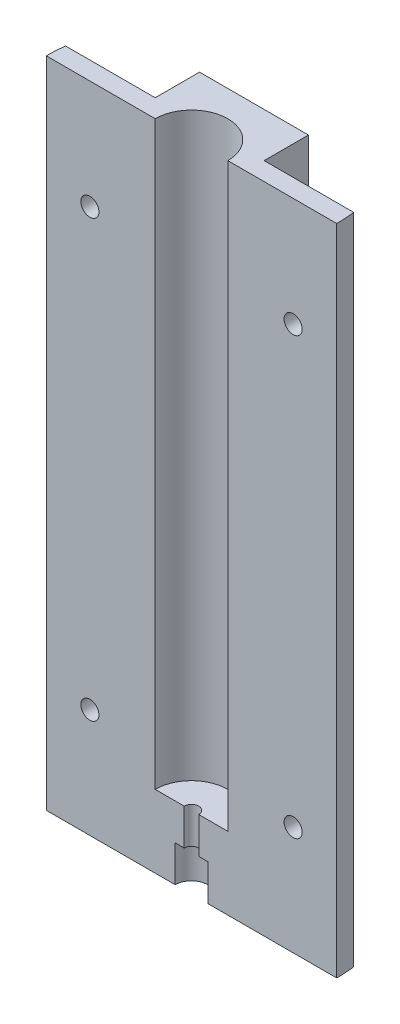
from build123d import *

# Parameters (mm, degrees)
AUFSATZ_LINEAR_AUSTRAGEN1_DEPTH       = 90
AUFSATZ_LINEAR_AUSTRAGEN1_DEPTH_BACK  = 0.0001
SCHNITT_LINEAR_AUSTRAGEN1_DEPTH       = 80
AUFSATZ_LINEAR_START                  = -10.0001
AUFSATZ_LINEAR_AUSTRAGEN2_DEPTH       = 10.0001
SKIZZE45_R                            = 2.25
SCHNITT_LINEAR_AUSTRAGEN9_DEPTH       = 5
SCHNITT_LINEAR_AUSTRAGEN16_DEPTH      = 101.498845765
SCHNITT_LINEAR_AUSTRAGEN16_DEPTH_BACK = 101.498845765
F_2_5_2_5_DURCHMESSER_BOHRUNG1_D      = 2.5


# Read off the part's stored shape, not the designer's step: Aufsatz-Linear austragen2
with BuildPart() as part:
    # Skizze1 → Aufsatz-Linear austragen1 (new, two sides: drawn at the far end of the back side and taken through both)
    with BuildSketch(Plane(origin=(0, 0, 0), x_dir=(1, 0, 0), z_dir=(0, 1, 0)).offset(-AUFSATZ_LINEAR_AUSTRAGEN1_DEPTH_BACK)):
        with BuildLine():
            Line((0, 0), (40, 0))
            ThreePointArc((40, 0), (20, 20), (0, 0))
        make_face()
    extrude(amount=AUFSATZ_LINEAR_AUSTRAGEN1_DEPTH + AUFSATZ_LINEAR_AUSTRAGEN1_DEPTH_BACK)

    # Skizze15 → Schnitt-Linear austragen1 (cut)
    with BuildSketch(Plane(origin=(0, 90, 0), x_dir=(1, 0, 0), z_dir=(0, 1, 0))):
        with BuildLine():
            Line((25, 0), (15, 0))
            ThreePointArc((15, 0), (20, 5), (25, 0))
        make_face()
    extrude(amount=-SCHNITT_LINEAR_AUSTRAGEN1_DEPTH, mode=Mode.SUBTRACT)

    # Aufsatz-Linear austragen2 outline → Aufsatz-Linear austragen2 (cut)
    with BuildSketch(Plane(origin=(0, 10, 0), x_dir=(1, 0, 0), z_dir=(0, 1, 0)).offset(AUFSATZ_LINEAR_START)):
        with BuildLine():
            Line((19, 0), (21, 0))
            ThreePointArc((21, 0), (20, 1), (19, 0))
        make_face()
    extrude(amount=AUFSATZ_LINEAR_AUSTRAGEN2_DEPTH, mode=Mode.SUBTRACT)

    # Skizze45 → Schnitt-Linear austragen9 (cut)
    with BuildSketch(Plane.XZ.offset(0.0001)):
        with Locations((20, 0)):
            Circle(SKIZZE45_R)
    extrude(amount=-SCHNITT_LINEAR_AUSTRAGEN9_DEPTH, mode=Mode.SUBTRACT)

    # Skizze47 → Schnitt-Linear austragen16 (cut, two sides: drawn at the far end of the back side and taken through both)
    with BuildSketch(Plane.XZ.offset(0.0001).offset(-SCHNITT_LINEAR_AUSTRAGEN16_DEPTH_BACK)):
        Polygon((-96.877045312, -2.5), (0.156865167, -2.5), (12.5, -2.5), (12.5, -8.61), (27.5, -8.61), (27.5, -2.5), (39.843134833, -2.5), (136.877045312, -2.5), (136.877045312, -196.567820958), (-96.877045312, -196.567820958), align=None)
    extrude(amount=SCHNITT_LINEAR_AUSTRAGEN16_DEPTH + SCHNITT_LINEAR_AUSTRAGEN16_DEPTH_BACK, mode=Mode.SUBTRACT)

    # Ø2.5 (2.5) Durchmesser Bohrung1 (through all)
    with Locations(Plane.XY):
        with Locations((6, 75), (6, 15), (34, 75), (34, 15)):
            Hole(F_2_5_2_5_DURCHMESSER_BOHRUNG1_D / 2)


solid = part.part
